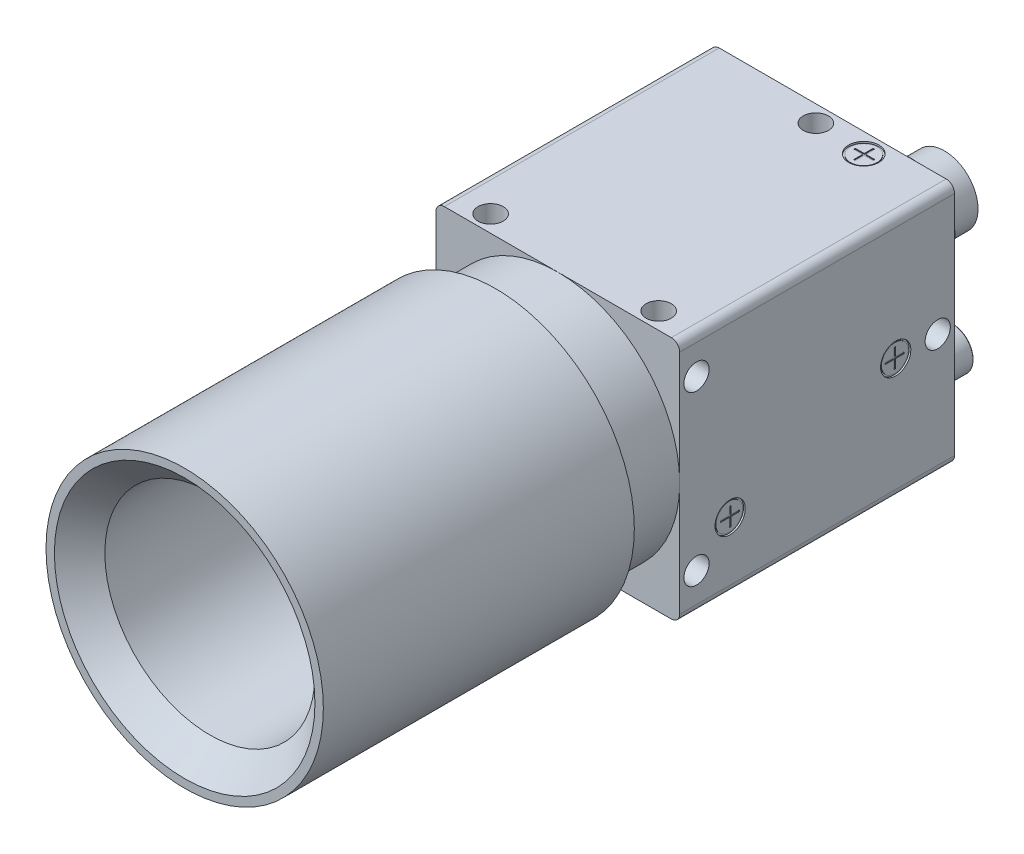
from build123d import *

# Parameters (mm, degrees)
SKETCH_2_W             = 29
SKETCH_2_H             = 29
EXTRUDE_1_DEPTH        = 32.7
SKETCH_3_R             = 14.5
SKETCH_3_R_2           = 12.5
EXTRUDE_2_DEPTH        = 7.4
CUT_EXTRUDE_1_DEPTH    = 5
CHAMFER_1_SIZE         = 1
CUT_EXTRUDE_START      = -1
CUT_EXTRUDE_2_DEPTH    = 1
SKETCH_7_R             = 1.8
EXTRUDE_6_DEPTH        = 0.8
FILLET_1_R             = 0.2
SKETCH_8_W             = 0.2
SKETCH_8_H             = 2
SKETCH_8_W_2           = 2
SKETCH_8_H_2           = 0.2
CUT_EXTRUDE_1_2_DEPTH  = 0.2
FILLET_2_R             = 0.2
FILLET_3_R             = 0.1
FILLET_3_OF_MIRROR_1_R = 0.1
FILLET_4_R             = 1
CUT_EXTRUDE_4_DEPTH    = 0.1
SKETCH_9_R             = 1.5
CUT_EXTRUDE_6_DEPTH    = 4
SKETCH_12_R            = 1.8
CUT_EXTRUDE_7_DEPTH    = 0.2
SKETCH_13_R            = 1.6
EXTRUDE_8_DEPTH        = 0.1
SKETCH_14_W            = 0.2
SKETCH_14_H            = 2.490008669
SKETCH_14_W_2          = 2.602384724
SKETCH_14_H_2          = 0.2
CUT_EXTRUDE_2_2_DEPTH  = 0.1
SKETCH_16_W            = 0.2
SKETCH_16_H            = 2.413460173
SKETCH_16_W_2          = 2.322581876
SKETCH_16_H_2          = 0.2
CUT_EXTRUDE_4_2_DEPTH  = 0.1
SKETCH_17_R            = 1.5
CUT_EXTRUDE_8_DEPTH    = 4
SKETCH_18_R            = 1.8
CUT_EXTRUDE_9_DEPTH    = 0.2
SKETCH_19_R            = 1.6
EXTRUDE_9_DEPTH        = 0.1
SKETCH_20_W            = 2.276941866
SKETCH_20_H            = 0.2
SKETCH_20_W_2          = 2.254561202
SKETCH_20_W_3          = 0.2
SKETCH_20_H_2          = 2.276941866
SKETCH_20_H_3          = 2.170733271
CUT_EXTRUDE_5_DEPTH    = 0.1
CUT_EXTRUDE_START_2    = -4
SKETCH_21_R            = 1.5
CUT_EXTRUDE_10_DEPTH   = 4
SKETCH_22_R            = 1.8
CUT_EXTRUDE_11_DEPTH   = 0.2
SKETCH_23_R            = 1.6
EXTRUDE_10_DEPTH       = 0.1
SKETCH_24_W            = 0.2
SKETCH_24_H            = 2.303417933
SKETCH_24_W_2          = 2.303417934
SKETCH_24_H_2          = 0.2
CUT_EXTRUDE_6_2_DEPTH  = 0.1
EXTRUDE_11_DEPTH       = 1.5
SKETCH_26_W            = 10
SKETCH_26_H            = 10
CUT_EXTRUDE_12_DEPTH   = 3
FILLET_5_R             = 1
EXTRUDE_12_DEPTH       = 3.3
SKETCH_28_R            = 1.5
CUT_EXTRUDE_13_DEPTH   = 4
CHAMFER_2_SIZE         = 0.1
EXTRUDE_13_DEPTH       = 1.3
SKETCH_30_R            = 4.5
CUT_EXTRUDE_14_DEPTH   = 1
SKETCH_31_R            = 4
SKETCH_31_R_2          = 3.5
EXTRUDE_14_DEPTH       = 5
SKETCH_32_R            = 16.5
SKETCH_32_R_2          = 12.5
EXTRUDE_15_DEPTH       = 37
CHAMFER_3_SIZE         = 3


# Some blends are built 0.0001 mm under size
with BuildPart() as part:
    # 草图2 → 凸台-拉伸1 (new body)
    with BuildSketch(Plane.XY):
        Rectangle(SKETCH_2_W, SKETCH_2_H)
    extrude(amount=EXTRUDE_1_DEPTH)

    # 草图3 → 凸台-拉伸2 (add)
    with BuildSketch(Plane.XY.offset(32.7)):
        Circle(SKETCH_3_R)
        Circle(SKETCH_3_R_2, mode=Mode.SUBTRACT)
    extrude(amount=EXTRUDE_2_DEPTH)

    # 草图4 → Cut-Extrude 1 (cut)
    with BuildSketch(Plane.XY.offset(32.7)):
        Polygon((6, 7.5), (7.5, 6), (7.5, -6), (6, -7.5), (-6, -7.5), (-7.5, -6), (-7.5, 6), (-6, 7.5), align=None)
    extrude(amount=-CUT_EXTRUDE_1_DEPTH, mode=Mode.SUBTRACT)

    # 倒角1
    chamfer_1_edges = [part.edges().sort_by_distance(p)[0] for p in [
        (-6.75, 6.75, 32.7),
        (-7.5, 0, 32.7),
        (-6.75, -6.75, 32.7),
        (0, -7.5, 32.7),
        (6.75, -6.75, 32.7),
        (7.5, 0, 32.7),
        (6.75, 6.75, 32.7),
        (0, 7.5, 32.7),
    ]]
    chamfer(chamfer_1_edges, length=CHAMFER_1_SIZE)

    # 草图5 → Cut-Extrude 2 (cut)
    with BuildSketch(Plane.XY.offset(32.7).offset(CUT_EXTRUDE_START)):
        with BuildLine():
            Line((-2, -10.5), (-2, -12.338962679))
            ThreePointArc((-2, -12.338962679), (0, -12.5), (2, -12.338962679))
            Line((2, -12.338962679), (2, -10.5))
            ThreePointArc((2, -10.5), (0, -8.5), (-2, -10.5))
        make_face()
    cut_extrude_2 = extrude(amount=CUT_EXTRUDE_2_DEPTH, mode=Mode.SUBTRACT)

    # 草图7 → 凸台-拉伸6 (add)
    with BuildSketch(Plane.XY.offset(31.7)):
        with Locations((0, -10.5)):
            Circle(SKETCH_7_R)
    extrude_6 = extrude(amount=EXTRUDE_6_DEPTH)

    # 圆角1
    fillet_1_edges = [part.edges().sort_by_distance(p)[0] for p in [
        (-1.8, -10.5, 32.5),
    ]]
    fillet(fillet_1_edges, radius=FILLET_1_R)

    # 草图8 → Cut-Extrude 1 2 (cut)
    with BuildSketch(Plane.XY.offset(32.5)):
        with Locations((0, -10.5)):
            Rectangle(SKETCH_8_W, SKETCH_8_H)
        with Locations((0, -10.5)):
            Rectangle(SKETCH_8_W_2, SKETCH_8_H_2)
    cut_extrude_1_2 = extrude(amount=-CUT_EXTRUDE_1_2_DEPTH, mode=Mode.SUBTRACT)

    # 圆角2
    fillet_2_edges = [part.edges().sort_by_distance(p)[0] for p in [
        (-0.1, -10.4, 32.4),
        (0.1, -10.6, 32.4),
        (0.1, -10.4, 32.4),
        (-0.1, -10.6, 32.4),
    ]]
    fillet(fillet_2_edges, radius=FILLET_2_R)

    # 圆角3
    fillet_3_edges = [part.edges().sort_by_distance(p)[0] for p in [
        (-1, -10.4, 32.4),
        (-0.1, -11.5, 32.4),
        (0.1, -11.5, 32.4),
        (-1, -10.6, 32.4),
        (1, -10.6, 32.4),
        (1, -10.4, 32.4),
        (0.1, -9.5, 32.4),
        (-0.1, -9.5, 32.4),
    ]]
    fillet(fillet_3_edges, radius=FILLET_3_R - 0.0001)  # a hair under: the kernel refuses the full size

    # 镜向2: Cut-Extrude 2 across plane
    add(cut_extrude_2.mirror(Plane.ZX), mode=Mode.SUBTRACT)

    # 镜向1: 凸台-拉伸6, Cut-Extrude 1 2 across plane
    add(extrude_6.mirror(Plane.ZX))
    add(cut_extrude_1_2.mirror(Plane.ZX), mode=Mode.SUBTRACT)

    # 圆角3 of 镜向1
    fillet_3_of_mirror_1_edges = [part.edges().sort_by_distance(p)[0] for p in [
        (-1, 10.4, 32.4),
        (-0.1, 11.5, 32.4),
        (0.1, 11.5, 32.4),
        (-1, 10.6, 32.4),
        (1, 10.6, 32.4),
        (1, 10.4, 32.4),
        (0.1, 9.5, 32.4),
        (-0.1, 9.5, 32.4),
    ]]
    fillet(fillet_3_of_mirror_1_edges, radius=FILLET_3_OF_MIRROR_1_R - 0.0001)  # a hair under: the kernel refuses the full size

    # 圆角4
    fillet_4_edges = [part.edges().sort_by_distance(p)[0] for p in [
        (14.5, -14.5, 16.35),
        (-14.5, -14.5, 16.35),
        (-14.5, 14.5, 16.35),
        (14.5, 14.5, 16.35),
    ]]
    fillet(fillet_4_edges, radius=FILLET_4_R)

    # 草图10 → Cut-Extrude 4 (cut)
    with BuildSketch(Plane.XZ.offset(14.5)):
        with BuildLine():
            ThreePointArc((-12, 6), (-11.707106781, 5.292893219), (-11, 5))
            Line((-11, 5), (11, 5))
            ThreePointArc((11, 5), (11.707106781, 5.292893219), (12, 6))
            Line((12, 6), (12, 24))
            ThreePointArc((12, 24), (11.707106781, 24.707106781), (11, 25))
            Line((11, 25), (-11, 25))
            ThreePointArc((-11, 25), (-11.707106781, 24.707106781), (-12, 24))
            Line((-12, 24), (-12, 6))
        make_face()
    extrude(amount=-CUT_EXTRUDE_4_DEPTH, mode=Mode.SUBTRACT)

    # 草图9 → Cut-Extrude 6 (cut)
    with BuildSketch(Plane.XZ.offset(14.5)):
        with Locations(Location((-10, 2, 0), (0, 0, 270))):
            Circle(SKETCH_9_R)
        with Locations(Location((-10, 30.7, 0), (0, 0, 270))):
            Circle(SKETCH_9_R)
        with Locations(Location((10, 30.7, 0), (0, 0, 90))):
            Circle(SKETCH_9_R)
        with Locations(Location((10, 2, 0), (0, 0, 90))):
            Circle(SKETCH_9_R)
    extrude(amount=-CUT_EXTRUDE_6_DEPTH, mode=Mode.SUBTRACT)

    # 草图12 → 切除-拉伸7 (cut, symmetric)
    with BuildSketch(Plane.XZ.offset(14.4)):
        with Locations(Location((-10, 7.6, 0), (0, 0, 270))):
            Circle(SKETCH_12_R)
        with Locations(Location((10, 7.6, 0), (0, 0, 270))):
            Circle(SKETCH_12_R)
        with Locations(Location((-5, 28.9, 0), (0, 0, 270))):
            Circle(SKETCH_12_R)
        with Locations(Location((5, 28.9, 0), (0, 0, 270))):
            Circle(SKETCH_12_R)
    extrude(amount=CUT_EXTRUDE_7_DEPTH, both=True, mode=Mode.SUBTRACT)

    # 草图13 → 凸台-拉伸8 (add)
    with BuildSketch(Plane.XZ.offset(14.2)):
        with Locations(Location((-10, 7.6, 0), (0, 0, 270))):
            Circle(SKETCH_13_R)
        with Locations(Location((10, 7.6, 0), (0, 0, 270))):
            Circle(SKETCH_13_R)
        with Locations(Location((5, 28.9, 0), (0, 0, 270))):
            Circle(SKETCH_13_R)
        with Locations(Location((-5, 28.9, 0), (0, 0, 270))):
            Circle(SKETCH_13_R)
    extrude(amount=EXTRUDE_8_DEPTH)

    # 草图14 → Cut-Extrude 2 2 (cut)
    with BuildSketch(Plane.XZ.offset(14.3)):
        with Locations((-10, 7.552537132)):
            Rectangle(SKETCH_14_W, SKETCH_14_H)
        with Locations((-10.024597811, 7.6)):
            Rectangle(SKETCH_14_W_2, SKETCH_14_H_2)
    cut_extrude_2_2 = extrude(amount=-CUT_EXTRUDE_2_2_DEPTH, mode=Mode.SUBTRACT)

    # 镜向3: Cut-Extrude 2 2 across plane
    add(cut_extrude_2_2.mirror(Plane(origin=(0, 0, 0), x_dir=(0, 0, 1), z_dir=(1, 0, 0))), mode=Mode.SUBTRACT)

    # 草图16 → Cut-Extrude 4 2 (cut)
    with BuildSketch(Plane.XZ.offset(14.3)):
        with Locations((-5, 28.970055446)):
            Rectangle(SKETCH_16_W, SKETCH_16_H)
        with Locations((-5.115494594, 28.9)):
            Rectangle(SKETCH_16_W_2, SKETCH_16_H_2)
    cut_extrude_4_2 = extrude(amount=-CUT_EXTRUDE_4_2_DEPTH, mode=Mode.SUBTRACT)

    # 镜向4: Cut-Extrude 4 2 across plane
    add(cut_extrude_4_2.mirror(Plane(origin=(0, 0, 0), x_dir=(0, 0, 1), z_dir=(1, 0, 0))), mode=Mode.SUBTRACT)

    # 草图17 → 切除-拉伸8 (cut)
    with BuildSketch(Plane(origin=(14.5, 0, 0), x_dir=(0, 0, -1), z_dir=(1, 0, 0))):
        with Locations(Location((-2, 0, 0), (0, 0, 90))):
            Circle(SKETCH_17_R)
        with Locations(Location((-30.7, -10, 0), (0, 0, 90))):
            Circle(SKETCH_17_R)
        with Locations(Location((-30.7, 10, 0), (0, 0, 90))):
            Circle(SKETCH_17_R)
    cut_extrude_8 = extrude(amount=-CUT_EXTRUDE_8_DEPTH, mode=Mode.SUBTRACT)

    # 草图18 → 切除-拉伸9 (cut)
    with BuildSketch(Plane(origin=(14.5, 0, 0), x_dir=(0, 0, -1), z_dir=(1, 0, 0))):
        with Locations(Location((-7, 0, 0), (0, 0, 90))):
            Circle(SKETCH_18_R)
        with Locations(Location((-26.7, -6.5, 0), (0, 0, 90))):
            Circle(SKETCH_18_R)
    cut_extrude_9 = extrude(amount=-CUT_EXTRUDE_9_DEPTH, mode=Mode.SUBTRACT)

    # 草图19 → 凸台-拉伸9 (add)
    with BuildSketch(Plane(origin=(14.3, 0, 0), x_dir=(0, 0, -1), z_dir=(1, 0, 0))):
        with Locations(Location((-7, 0, 0), (0, 0, 90))):
            Circle(SKETCH_19_R)
        with Locations(Location((-26.7, -6.5, 0), (0, 0, 90))):
            Circle(SKETCH_19_R)
    extrude_9 = extrude(amount=EXTRUDE_9_DEPTH)

    # 草图20 → 切除-拉伸-薄壁5 (cut)
    with BuildSketch(Plane(origin=(14.4, 0, 0), x_dir=(0, 0, -1), z_dir=(1, 0, 0))):
        with Locations((-7.023774445, 0)):
            Rectangle(SKETCH_20_W, SKETCH_20_H)
        with Locations((-26.625235525, -6.481012487)):
            Rectangle(SKETCH_20_W_2, SKETCH_20_H)
        with Locations((-7.023774445, 0)):
            Rectangle(SKETCH_20_W_3, SKETCH_20_H_2)
        with Locations((-26.603304395, -6.542747083)):
            Rectangle(SKETCH_20_W_3, SKETCH_20_H_3)
    cut_extrude_5 = extrude(amount=-CUT_EXTRUDE_5_DEPTH, mode=Mode.SUBTRACT)

    # 镜向5: 切除-拉伸9, 凸台-拉伸9, 切除-拉伸-薄壁5 across plane
    add(cut_extrude_9.mirror(Plane(origin=(0, 0, 0), x_dir=(0, 0, 1), z_dir=(1, 0, 0))), mode=Mode.SUBTRACT)
    add(extrude_9.mirror(Plane(origin=(0, 0, 0), x_dir=(0, 0, 1), z_dir=(1, 0, 0))))
    add(cut_extrude_5.mirror(Plane(origin=(0, 0, 0), x_dir=(0, 0, 1), z_dir=(1, 0, 0))), mode=Mode.SUBTRACT)

    # 镜向6: 切除-拉伸8 across plane
    add(cut_extrude_8.mirror(Plane(origin=(0, 0, 0), x_dir=(0, 0, 1), z_dir=(1, 0, 0))), mode=Mode.SUBTRACT)

    # 草图21 → 切除-拉伸10 (cut)
    with BuildSketch(Plane(origin=(0, 14.5, 0), x_dir=(1, 0, 0), z_dir=(0, 1, 0)).offset(CUT_EXTRUDE_START_2)):
        with Locations(Location((10, -30.7, 0), (0, 0, 70.528779366))):
            Circle(SKETCH_21_R)
        with Locations(Location((-10, -30.7, 0), (0, 0, 90))):
            Circle(SKETCH_21_R)
        with Locations(Location((0, -2, 0), (0, 0, 270))):
            Circle(SKETCH_21_R)
    extrude(amount=CUT_EXTRUDE_10_DEPTH, mode=Mode.SUBTRACT)

    # 草图22 → 切除-拉伸11 (cut)
    with BuildSketch(Plane(origin=(0, 14.5, 0), x_dir=(1, 0, 0), z_dir=(0, 1, 0))):
        with Locations(Location((6, -2.3, 0), (0, 0, 270))):
            Circle(SKETCH_22_R)
    extrude(amount=-CUT_EXTRUDE_11_DEPTH, mode=Mode.SUBTRACT)

    # 草图23 → 凸台-拉伸10 (add)
    with BuildSketch(Plane(origin=(0, 14.3, 0), x_dir=(1, 0, 0), z_dir=(0, 1, 0))):
        with Locations(Location((6, -2.3, 0), (0, 0, 270))):
            Circle(SKETCH_23_R)
    extrude(amount=EXTRUDE_10_DEPTH)

    # 草图24 → Cut-Extrude 6 2 (cut)
    with BuildSketch(Plane(origin=(0, 14.4, 0), x_dir=(1, 0, 0), z_dir=(0, 1, 0))):
        with Locations((6, -2.244844135)):
            Rectangle(SKETCH_24_W, SKETCH_24_H)
        with Locations((6, -2.244844135)):
            Rectangle(SKETCH_24_W_2, SKETCH_24_H_2)
    extrude(amount=-CUT_EXTRUDE_6_2_DEPTH, mode=Mode.SUBTRACT)

    # 草图25 → 凸台-拉伸11 (add)
    with BuildSketch(Plane(origin=(0, 0, 0), x_dir=(-1, 0, 0), z_dir=(0, 0, -1))):
        with BuildLine():
            Line((-6.5, 0), (6.5, 0))
            ThreePointArc((6.5, 0), (7.207106781, -0.292893219), (7.5, -1))
            Line((7.5, -1), (7.5, -1.145640287))
            ThreePointArc((7.5, -1.145640287), (8.258904734, -3.454077717), (10.239534806, -4.861886043))
            ThreePointArc((10.239534806, -4.861886043), (12, -7.25), (10.239534806, -9.638113957))
            ThreePointArc((10.239534806, -9.638113957), (8.258904734, -11.045922283), (7.5, -13.354359713))
            Line((7.5, -13.354359713), (7.5, -13.5))
            ThreePointArc((7.5, -13.5), (7.207106781, -14.207106781), (6.5, -14.5))
            Line((6.5, -14.5), (-6.5, -14.5))
            ThreePointArc((-6.5, -14.5), (-7.207106781, -14.207106781), (-7.5, -13.5))
            Line((-7.5, -13.5), (-7.5, -13.354359713))
            ThreePointArc((-7.5, -13.354359713), (-8.258904734, -11.045922283), (-10.239534806, -9.638113957))
            ThreePointArc((-10.239534806, -9.638113957), (-12, -7.25), (-10.239534806, -4.861886043))
            ThreePointArc((-10.239534806, -4.861886043), (-8.258904734, -3.454077717), (-7.5, -1.145640287))
            Line((-7.5, -1.145640287), (-7.5, -1))
            ThreePointArc((-7.5, -1), (-7.207106781, -0.292893219), (-6.5, 0))
        make_face()
    extrude(amount=EXTRUDE_11_DEPTH)

    # 草图26 → 切除-拉伸12 (cut)
    with BuildSketch(Plane(origin=(0, 0, -1.5), x_dir=(-1, 0, 0), z_dir=(0, 0, -1))):
        with Locations((0, -7.25)):
            Rectangle(SKETCH_26_W, SKETCH_26_H)
    extrude(amount=-CUT_EXTRUDE_12_DEPTH, mode=Mode.SUBTRACT)

    # 圆角5
    fillet_5_edges = [part.edges().sort_by_distance(p)[0] for p in [
        (-5, -2.25, 0),
        (-5, -12.25, 0),
        (5, -12.25, 0),
        (5, -2.25, 0),
    ]]
    fillet(fillet_5_edges, radius=FILLET_5_R)

    # 草图27 → 凸台-拉伸12 (add)
    with BuildSketch(Plane(origin=(0, 0, -1.5), x_dir=(-1, 0, 0), z_dir=(0, 0, -1))):
        with BuildLine():
            Line((-9.5, -4.75), (-5, -4.75))
            Line((-5, -4.75), (-5, -9.75))
            Line((-5, -9.75), (-9.5, -9.75))
            ThreePointArc((-9.5, -9.75), (-12, -7.25), (-9.5, -4.75))
        make_face()
        with BuildLine():
            Line((5, -4.75), (9.5, -4.75))
            ThreePointArc((9.5, -4.75), (12, -7.25), (9.5, -9.75))
            Line((9.5, -9.75), (5, -9.75))
            Line((5, -9.75), (5, -4.75))
        make_face()
    extrude(amount=EXTRUDE_12_DEPTH)

    # 草图28 → 切除-拉伸13 (cut)
    with BuildSketch(Plane(origin=(0, 0, -4.8), x_dir=(-1, 0, 0), z_dir=(0, 0, -1))):
        with Locations((-9.5, -7.25)):
            Circle(SKETCH_28_R)
        with Locations((9.5, -7.25)):
            Circle(SKETCH_28_R)
    extrude(amount=-CUT_EXTRUDE_13_DEPTH, mode=Mode.SUBTRACT)

    # 倒角2
    # the kernel refuses this chamfer: 0.1 mm, written as the material it takes off along each edge
    with BuildSketch(Plane(origin=(6.5, -13.5, -1.5), x_dir=(0, -1, 0), z_dir=(-1, 0, 0))) as chamfer_2_piece_1:
        Polygon((1 - CHAMFER_2_SIZE, 0), (1, CHAMFER_2_SIZE), (1, 0), align=None)
    revolve(axis=Axis((6.5, -13.5, -1.5), (0, 0, 1)), revolution_arc=90, mode=Mode.SUBTRACT)
    with BuildSketch(Plane(origin=(-6.5, -14.5, -1.5), x_dir=(0, 0.9996219169112966, -0.027495876610587656), z_dir=(1, 0, 0)), Plane(origin=(6.5, 0, -1.5), x_dir=(0, -0.9996219169112966, -0.027495876610587448), z_dir=(-1, 0, 0))) as chamfer_2_piece_2:
        Polygon((CHAMFER_2_SIZE * 0.999621916911, CHAMFER_2_SIZE * 0.0274958766106), (-CHAMFER_2_SIZE * 0.0274958766106, CHAMFER_2_SIZE * 0.999621916911), (0, 0), align=None)
    extrude(amount=13, mode=Mode.SUBTRACT)
    with BuildSketch(Plane(origin=(-6.5, -13.5, -1.5), x_dir=(-1, 0, 0), z_dir=(0, 1, 0))) as chamfer_2_piece_3:
        Polygon((1 - CHAMFER_2_SIZE, 0), (1, CHAMFER_2_SIZE), (1, 0), align=None)
    revolve(axis=Axis((-6.5, -13.5, -1.5), (0, 0, 1)), revolution_arc=90, mode=Mode.SUBTRACT)
    with BuildSketch(Plane(origin=(-7.5, -13.354359713, -1.5), x_dir=(0.9996219169112966, 0, -0.02749587661058742), z_dir=(0, -1, 0)), Plane(origin=(-7.5, -1, -1.5), x_dir=(0.9996219169112966, 0, -0.02749587661058742), z_dir=(0, -1, 0)), Plane(origin=(7.5, -1.145640287, -1.5), x_dir=(-0.9996219169112966, 0, -0.02749587661058742), z_dir=(0, 1, 0)), Plane(origin=(7.5, -13.5, -1.5), x_dir=(-0.9996219169112966, -6.096133374550444e-15, -0.02749587661058742), z_dir=(0, 1, 0))) as chamfer_2_piece_4:
        Polygon((CHAMFER_2_SIZE * 0.999621916911, CHAMFER_2_SIZE * 0.0274958766106), (-CHAMFER_2_SIZE * 0.0274958766106, CHAMFER_2_SIZE * 0.999621916911), (0, 0), align=None)
    extrude(amount=0.145640287, mode=Mode.SUBTRACT)
    with BuildSketch(Plane(origin=(-11.390356389, -13.354359713, -1.5), x_dir=(0.2320513264200915, 0.9727035426617281, 0), z_dir=(-0.9727035426617281, 0.2320513264200915, 0))) as chamfer_2_piece_5_section:
        Polygon((3.890356389 + CHAMFER_2_SIZE, 0), (3.890356389, -CHAMFER_2_SIZE), (3.890356389, 0), align=None)
    chamfer_2_piece_5 = revolve(axis=Axis((-11.390356389, -13.354359713, -1.5), (0, 0, -1)), revolution_arc=76.58212795, mode=Mode.PRIVATE)
    chamfer_2_piece_5 = chamfer_2_piece_5 - Plane(origin=(-9.5, -7.25, -1.452097318), x_dir=(0, 1, 0), z_dir=(0, 0, 1)) * Cylinder(2.5, 16, mode=Mode.PRIVATE)
    add(chamfer_2_piece_5, mode=Mode.SUBTRACT)
    with BuildSketch(Plane(origin=(-11.390356389, -1.145640287, -1.5), x_dir=(1, 0, 0), z_dir=(0, 1, 0))) as chamfer_2_piece_6_section:
        Polygon((3.890356389 + CHAMFER_2_SIZE, 0), (3.890356389, -CHAMFER_2_SIZE), (3.890356389, 0), align=None)
    chamfer_2_piece_6 = revolve(axis=Axis((-11.390356389, -1.145640287, -1.5), (0, 0, -1)), revolution_arc=76.58212795, mode=Mode.PRIVATE)
    chamfer_2_piece_6 = chamfer_2_piece_6 - Plane(origin=(-9.5, -7.25, -1.452097319), x_dir=(0, 1, 0), z_dir=(0, 0, 1)) * Cylinder(2.5, 16, mode=Mode.PRIVATE)
    add(chamfer_2_piece_6, mode=Mode.SUBTRACT)
    with BuildSketch(Plane(origin=(-6.5, -1, -1.5), x_dir=(0, 1, 0), z_dir=(1, 0, 0))) as chamfer_2_piece_7:
        Polygon((1 - CHAMFER_2_SIZE, 0), (1, CHAMFER_2_SIZE), (1, 0), align=None)
    revolve(axis=Axis((-6.5, -1, -1.5), (0, 0, 1)), revolution_arc=90, mode=Mode.SUBTRACT)
    with BuildSketch(Plane(origin=(6.5, -1, -1.5), x_dir=(1, 0, 0), z_dir=(0, -1, 0))) as chamfer_2_piece_8:
        Polygon((1 - CHAMFER_2_SIZE, 0), (1, CHAMFER_2_SIZE), (1, 0), align=None)
    revolve(axis=Axis((6.5, -1, -1.5), (0, 0, 1)), revolution_arc=90, mode=Mode.SUBTRACT)
    with BuildSketch(Plane(origin=(11.390356389, -1.145640287, -1.5), x_dir=(-0.23205132642008852, -0.9727035426617286, 0), z_dir=(0.9727035426617286, -0.23205132642008852, 0))) as chamfer_2_piece_9_section:
        Polygon((3.890356389 + CHAMFER_2_SIZE, 0), (3.890356389, -CHAMFER_2_SIZE), (3.890356389, 0), align=None)
    chamfer_2_piece_9 = revolve(axis=Axis((11.390356389, -1.145640287, -1.5), (0, 0, -1)), revolution_arc=76.58212795, mode=Mode.PRIVATE)
    chamfer_2_piece_9 = chamfer_2_piece_9 - Plane(origin=(9.5, -7.25, -1.452097318), x_dir=(0, -1, 0), z_dir=(0, 0, 1)) * Cylinder(2.5, 16, mode=Mode.PRIVATE)
    add(chamfer_2_piece_9, mode=Mode.SUBTRACT)
    with BuildSketch(Plane(origin=(11.390356389, -13.354359713, -1.5), x_dir=(-1, 0, 0), z_dir=(0, -1, 0))) as chamfer_2_piece_10_section:
        Polygon((3.890356389 + CHAMFER_2_SIZE, 0), (3.890356389, -CHAMFER_2_SIZE), (3.890356389, 0), align=None)
    chamfer_2_piece_10 = revolve(axis=Axis((11.390356389, -13.354359713, -1.5), (0, 0, -1)), revolution_arc=76.58212795, mode=Mode.PRIVATE)
    chamfer_2_piece_10 = chamfer_2_piece_10 - Plane(origin=(9.5, -7.25, -1.452097319), x_dir=(0, -1, 0), z_dir=(0, 0, 1)) * Cylinder(2.5, 16, mode=Mode.PRIVATE)
    add(chamfer_2_piece_10, mode=Mode.SUBTRACT)
    with BuildSketch(Plane(origin=(-4, -12.25, -1.5), x_dir=(0, -0.9996219169112966, -0.027495876610587656), z_dir=(1, 0, 0)), Plane(origin=(4, -2.25, -1.5), x_dir=(0, 0.9996219169112966, -0.02749587661058742), z_dir=(-1, 0, 0))) as chamfer_2_piece_11:
        Polygon((CHAMFER_2_SIZE * 0.999621916911, -CHAMFER_2_SIZE * 0.0274958766106), (-CHAMFER_2_SIZE * 0.0274958766106, -CHAMFER_2_SIZE * 0.999621916911), (0, 0), align=None)
    extrude(amount=8, mode=Mode.SUBTRACT)
    with BuildSketch(Plane(origin=(5, -4.75, -1.5), x_dir=(0.9996219169112966, 0, -0.02749587661058742), z_dir=(0, 1, 0)), Plane(origin=(-5, -3.25, -1.5), x_dir=(-0.9996219169112966, 0, -0.02749587661058742), z_dir=(0, -1, 0))) as chamfer_2_piece_12:
        Polygon((CHAMFER_2_SIZE * 0.999621916911, -CHAMFER_2_SIZE * 0.0274958766106), (-CHAMFER_2_SIZE * 0.0274958766106, -CHAMFER_2_SIZE * 0.999621916911), (0, 0), align=None)
    extrude(amount=1.5, mode=Mode.SUBTRACT)
    with BuildSketch(Plane(origin=(-5, -9.75, -1.5), x_dir=(0.027495876610587302, 0, 0.9996219169112966), z_dir=(0, -1, 0)), Plane(origin=(5, -11.25, -1.5), x_dir=(-0.027495876610587302, 0, 0.9996219169112966), z_dir=(0, 1, 0))) as chamfer_2_piece_13:
        Polygon((CHAMFER_2_SIZE * 0.999621916911, CHAMFER_2_SIZE * 0.0274958766106), (-CHAMFER_2_SIZE * 0.0274958766106, CHAMFER_2_SIZE * 0.999621916911), (0, 0), align=None)
    extrude(amount=1.5, mode=Mode.SUBTRACT)
    with BuildSketch(Plane(origin=(4, -11.25, -1.5), x_dir=(0, -1, 0), z_dir=(-1, 0, 0))) as chamfer_2_piece_14:
        Polygon((1 + CHAMFER_2_SIZE, 0), (1, CHAMFER_2_SIZE), (1, 0), align=None)
    revolve(axis=Axis((4, -11.25, -1.5), (0, 0, 1)), revolution_arc=90, mode=Mode.SUBTRACT)
    with BuildSketch(Plane(origin=(-4, -11.25, -1.5), x_dir=(-1, 0, 0), z_dir=(0, 1, 0))) as chamfer_2_piece_15:
        Polygon((1, CHAMFER_2_SIZE), (1 + CHAMFER_2_SIZE, 0), (1, 0), align=None)
    revolve(axis=Axis((-4, -11.25, -1.5), (0, 0, 1)), revolution_arc=90, mode=Mode.SUBTRACT)
    with BuildSketch(Plane(origin=(-4, -3.25, -1.5), x_dir=(0, 1, 0), z_dir=(1, 0, 0))) as chamfer_2_piece_16:
        Polygon((1 + CHAMFER_2_SIZE, 0), (1, CHAMFER_2_SIZE), (1, 0), align=None)
    revolve(axis=Axis((-4, -3.25, -1.5), (0, 0, 1)), revolution_arc=90, mode=Mode.SUBTRACT)
    with BuildSketch(Plane(origin=(4, -3.25, -1.5), x_dir=(0, 1, 0), z_dir=(-1, 0, 0))) as chamfer_2_piece_17:
        Polygon((1 + CHAMFER_2_SIZE, 0), (1, -CHAMFER_2_SIZE), (1, 0), align=None)
    revolve(axis=Axis((4, -3.25, -1.5), (0, 0, -1)), revolution_arc=90, mode=Mode.SUBTRACT)
    with BuildSketch(Plane(origin=(9.5, -7.25, -4.8), x_dir=(0, -1, 0), z_dir=(-1, 0, 0))) as chamfer_2_piece_18:
        Polygon((2.5, CHAMFER_2_SIZE), (2.5 - CHAMFER_2_SIZE, 0), (2.5, 0), align=None)
    revolve(axis=Axis((9.5, -7.25, -4.8), (0, 0, 1)), revolution_arc=180, mode=Mode.SUBTRACT)
    with BuildSketch(Plane(origin=(4.742831701, -9.75, -4.8), x_dir=(0, -0.02749587661057879, 0.999621916911297), z_dir=(1, 0, 0)), Plane(origin=(9.5, -4.75, -4.8), x_dir=(0, 0.02749587661058742, 0.9996219169112966), z_dir=(-1, 0, 0)), Plane(origin=(-4.742831701, -4.75, -4.8), x_dir=(0, 0.02749587661058742, 0.9996219169112966), z_dir=(-1, 0, 0)), Plane(origin=(-9.5, -9.75, -4.8), x_dir=(0, -0.02749587661057879, 0.999621916911297), z_dir=(1, 0, 0))) as chamfer_2_piece_19:
        Polygon((CHAMFER_2_SIZE * 0.999621916911, -CHAMFER_2_SIZE * 0.0274958766106), (-CHAMFER_2_SIZE * 0.0274958766106, -CHAMFER_2_SIZE * 0.999621916911), (0, 0), align=None)
    extrude(amount=4.757168299, mode=Mode.SUBTRACT)
    with BuildSketch(Plane(origin=(5, -4.492831701, -4.8), x_dir=(-0.02749587661058742, 0, 0.9996219169112966), z_dir=(0, -1, 0)), Plane(origin=(-5, -10.007168299, -4.8), x_dir=(0.02749587661058742, 0, 0.9996219169112966), z_dir=(0, 1, 0))) as chamfer_2_piece_20:
        Polygon((CHAMFER_2_SIZE * 0.999621916911, -CHAMFER_2_SIZE * 0.0274958766106), (-CHAMFER_2_SIZE * 0.0274958766106, -CHAMFER_2_SIZE * 0.999621916911), (0, 0), align=None)
    extrude(amount=5.514336598, mode=Mode.SUBTRACT)
    with BuildSketch(Plane(origin=(-9.5, -7.25, -4.8), x_dir=(0, 1, 0), z_dir=(1, 0, 0))) as chamfer_2_piece_21:
        Polygon((2.5, CHAMFER_2_SIZE), (2.5 - CHAMFER_2_SIZE, 0), (2.5, 0), align=None)
    revolve(axis=Axis((-9.5, -7.25, -4.8), (0, 0, 1)), revolution_arc=180, mode=Mode.SUBTRACT)
    with BuildSketch(Plane(origin=(9.5, -7.25, -4.8), x_dir=(-1, 0, 0), z_dir=(0, -1, 0))) as chamfer_2_piece_22:
        Polygon((1.5 + CHAMFER_2_SIZE, 0), (1.5, -CHAMFER_2_SIZE), (1.5, 0), align=None)
    revolve(axis=Axis((9.5, -7.25, -4.8), (0, 0, -1)), mode=Mode.SUBTRACT)
    with BuildSketch(Plane(origin=(-9.5, -7.25, -4.8), x_dir=(-1, 0, 0), z_dir=(0, -1, 0))) as chamfer_2_piece_23:
        Polygon((1.5 + CHAMFER_2_SIZE, 0), (1.5, -CHAMFER_2_SIZE), (1.5, 0), align=None)
    revolve(axis=Axis((-9.5, -7.25, -4.8), (0, 0, -1)), mode=Mode.SUBTRACT)

    # 草图29 → 凸台-拉伸13 (add)
    with BuildSketch(Plane(origin=(0, 0, 0), x_dir=(-1, 0, 0), z_dir=(0, 0, -1))):
        with BuildLine():
            Line((-0.963771457, 0), (-6.5, 0))
            ThreePointArc((-6.5, 0), (-7.207106781, -0.292893219), (-7.5, -1))
            Line((-7.5, -1), (-7.5, -1.145640287))
            ThreePointArc((-7.5, -1.145640287), (-7.627075409, -2.131839606), (-8, -3.053612087))
            ThreePointArc((-8, -3.053612087), (-7.98846034, 0.606059175), (-10.420121256, 3.34108241))
            ThreePointArc((-10.420121256, 3.34108241), (-9.881514736, 12.901265377), (-3.084012647, 6.157293203))
            ThreePointArc((-3.084012647, 6.157293203), (-3.13072386, 2.697513153), (-0.963771457, 0))
        make_face()
    extrude(amount=EXTRUDE_13_DEPTH)

    # 草图30 → 切除-拉伸14 (cut)
    with BuildSketch(Plane(origin=(0, 0, -1.3), x_dir=(-1, 0, 0), z_dir=(0, 0, -1))):
        with Locations((-8, 8)):
            Circle(SKETCH_30_R)
    extrude(amount=-CUT_EXTRUDE_14_DEPTH, mode=Mode.SUBTRACT)

    # 草图31 → 凸台-拉伸14 (add)
    with BuildSketch(Plane(origin=(0, 0, -0.3), x_dir=(-1, 0, 0), z_dir=(0, 0, -1))):
        with Locations((-8, 8)):
            Circle(SKETCH_31_R)
        with Locations((-8, 8)):
            Circle(SKETCH_31_R_2, mode=Mode.SUBTRACT)
    extrude(amount=EXTRUDE_14_DEPTH)

    # 草图32 → 凸台-拉伸15 (add)
    with BuildSketch(Plane.XY.offset(40.1)):
        Circle(SKETCH_32_R)
        with Locations(Location((0, 0, 0), (0, 0, 99.206896221))):
            Circle(SKETCH_32_R_2, mode=Mode.SUBTRACT)
    extrude(amount=EXTRUDE_15_DEPTH)

    # 倒角3
    chamfer_3_edges = [part.edges().sort_by_distance(p)[0] for p in [
        (2, -12.338962679, 77.1),
    ]]
    chamfer(chamfer_3_edges, length=CHAMFER_3_SIZE)


solid = part.part
